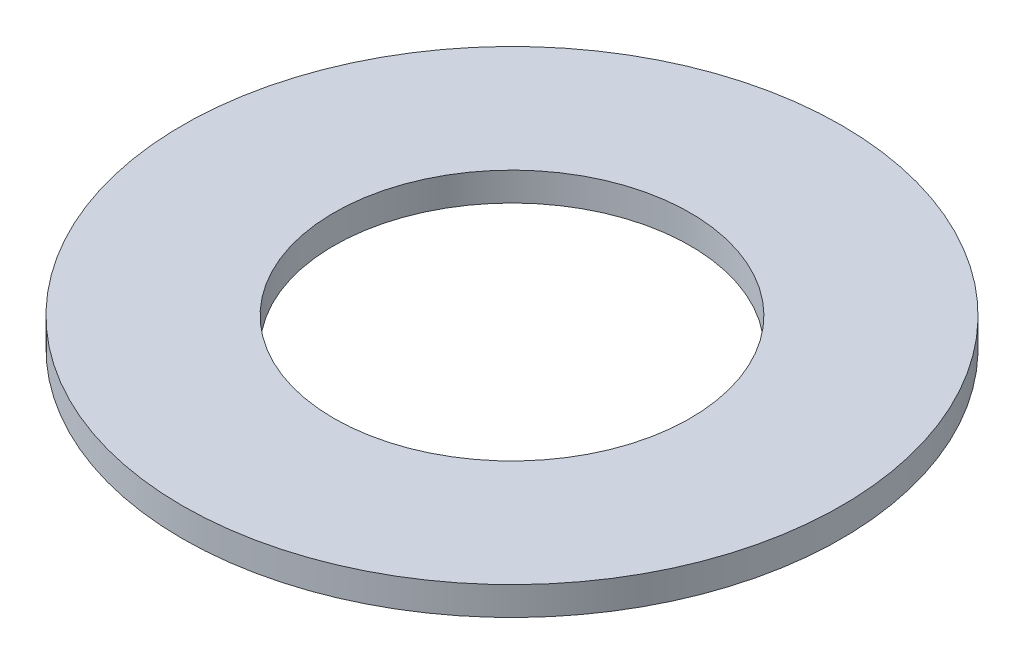
from build123d import *

# Parameters (mm, degrees)
SKETCH1_R           = 92.5
BOSS_EXTRUDE1_DEPTH = 8
SKETCH2_R           = 50
CUT_EXTRUDE1_DEPTH  = 132.059146953


with BuildPart() as part:
    # Sketch1 → Boss-Extrude1 (new body)
    with BuildSketch(Plane(origin=(0, 0, 0), x_dir=(1, 0, 0), z_dir=(0, 1, 0))):
        Circle(SKETCH1_R)
    extrude(amount=BOSS_EXTRUDE1_DEPTH)

    # Sketch2 → Cut-Extrude1 (cut, through all)
    with BuildSketch(Plane(origin=(0, 0, 0), x_dir=(1, 0, 0), z_dir=(0, 1, 0))):
        Circle(SKETCH2_R)
    extrude(amount=CUT_EXTRUDE1_DEPTH, mode=Mode.SUBTRACT)


solid = part.part
